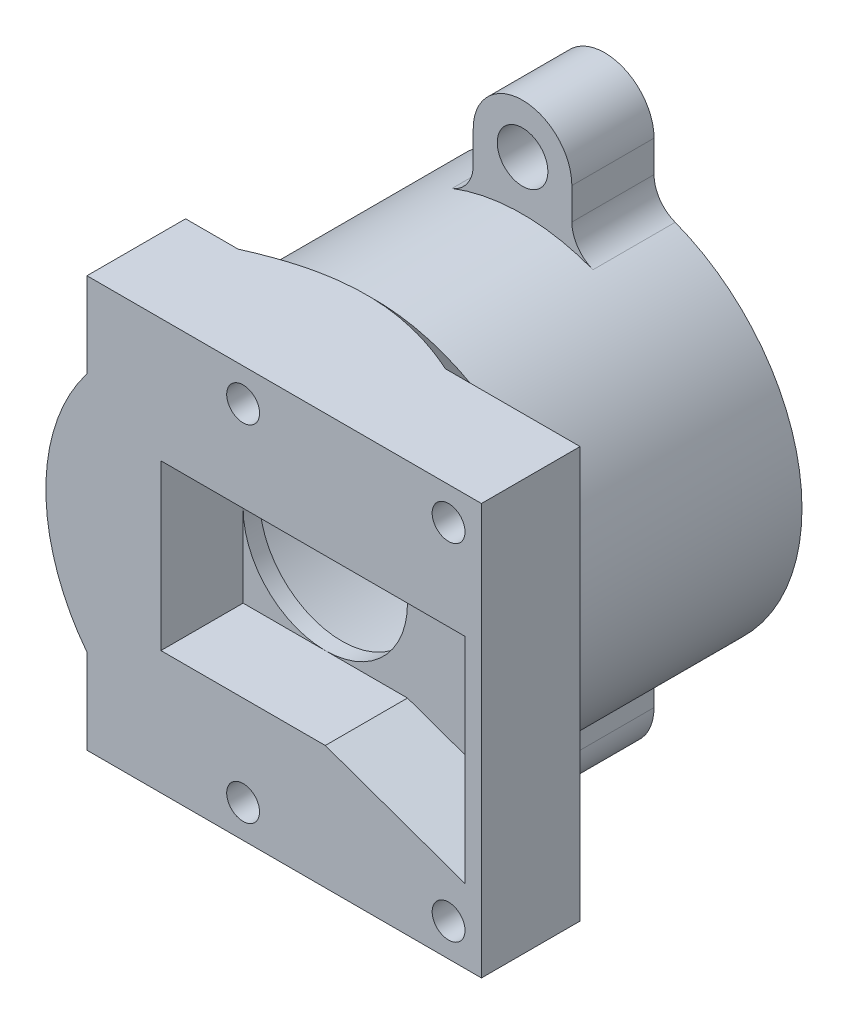
from build123d import *
from build123d.topology import SkipClean

# Parameters (mm, degrees)
SKETCH1_R               = 12
SKETCH1_R_2             = 4.75
BOSS_EXTRUDE1_DEPTH     = 2
SKETCH2_R               = 12
SKETCH2_R_2             = 10.871602624
BOSS_EXTRUDE3_DEPTH     = 20
BOSS_EXTRUDE4_START     = -5
SKETCH3_R               = 1.539073807
BOSS_EXTRUDE4_DEPTH     = 5
BOSS_EXTRUDE4_2_DEPTH   = 5
BOSS_EXTRUDE5_START     = -5
BOSS_EXTRUDE5_OUTLINE_R = 1
BOSS_EXTRUDE5_DEPTH     = 5
SKETCH5_4_R             = 1
CUT_EXTRUDE4_DEPTH      = 5
SKETCH6_R               = 1
BOSS_EXTRUDE11_DEPTH    = 1
CHAMFER1_SIZE           = 2
FILLET2_START           = -22
FILLET2_DEPTH           = 5
SKETCH7_R               = 12
BOSS_EXTRUDE13_DEPTH    = 1


with BuildPart() as part:
    # Sketch1 → Boss-Extrude1 (new body)
    with BuildSketch(Plane(origin=(0, 0, 0), x_dir=(0, 1, 0), z_dir=(0, 0, 1))):
        with Locations(Location((0, 0, 0), (0, 0, 270))):
            Circle(SKETCH1_R)
        with Locations(Location((0, 0, 0), (0, 0, 270))):
            Circle(SKETCH1_R_2, mode=Mode.SUBTRACT)
    extrude(amount=-BOSS_EXTRUDE1_DEPTH)

    # Sketch2 → Boss-Extrude3 (add)
    with BuildSketch(Plane(origin=(0, 0, -2), x_dir=(1, 0, 0), z_dir=(0, 0, -1))):
        Circle(SKETCH2_R)
        with Locations(Location((0, 0, 0), (0, 0, 180))):
            Circle(SKETCH2_R_2, mode=Mode.SUBTRACT)
    extrude(amount=BOSS_EXTRUDE3_DEPTH)

    # Boss-Extrude5: read off the stored shape, not the designer's step
    # Boss-Extrude5 outline → Boss-Extrude5 (add)
    # profile 1 of 2: a face of its own
    with BuildSketch(Plane.XY.offset(BOSS_EXTRUDE5_START)):
        with BuildLine():
            ThreePointArc((0.943785252, -10.83055922), (5.369140506, -9.453257314), (8.818682626, -6.357875459))
            Line((8.818682626, -6.357875459), (5, -5))
            Line((5, -5), (-5, -5))
            Line((-5, -5), (-5, 5))
            Line((-5, 5), (9.653587085, 5))
            ThreePointArc((9.653587085, 5), (6.047721085, 9.034202416), (0.943785252, 10.83055922))
            ThreePointArc((0.943785252, 10.83055922), (0, 9.5), (-0.943785252, 10.83055922))
            ThreePointArc((-0.943785252, 10.83055922), (-10.871602624, 0), (-0.943785252, -10.83055922))
            ThreePointArc((-0.943785252, -10.83055922), (0, -9.5), (0.943785252, -10.83055922))
        make_face()
    # profile 2 of 2: a face of its own
    with BuildSketch(Plane.XY.offset(BOSS_EXTRUDE5_START)):
        with BuildLine():
            Line((13.5, 5), (13.5, -8.022492971))
            Line((13.5, -8.022492971), (9.921541449, -6.750038169))
            ThreePointArc((9.921541449, -6.750038169), (0.359069733, -11.994626669), (-9.5, -7.331439149))
            Line((-9.5, -7.331439149), (-9.5, -12.5))
            Line((-9.5, -12.5), (14.5, -12.5))
            Line((14.5, -12.5), (14.5, 12.5))
            Line((14.5, 12.5), (-9.5, 12.5))
            Line((-9.5, 12.5), (-9.5, 7.331439149))
            ThreePointArc((-9.5, 7.331439149), (1.361991036, 11.922456979), (10.908712115, 5))
            Line((10.908712115, 5), (13.5, 5))
        make_face()
        with Locations((12.5, -10.5)):
            Circle(BOSS_EXTRUDE5_OUTLINE_R, mode=Mode.SUBTRACT)
        with Locations((12.5, 10.5)):
            Circle(BOSS_EXTRUDE5_OUTLINE_R, mode=Mode.SUBTRACT)
    extrude(amount=BOSS_EXTRUDE5_DEPTH)

    # Sketch5<4> → Cut-Extrude4 (cut)
    with SkipClean():  # the faces are left unmerged after this step: merging them gives an invalid solid
        with BuildSketch(Plane.XY):
            with BuildLine():
                ThreePointArc((-4.75, 0), (-3.358757211, 3.358757211), (0, 4.75))
                Line((0, 4.75), (0, 5))
                Line((0, 5), (-5, 5))
                Line((-5, 5), (-5, 0))
                Line((-5, 0), (-4.75, 0))
            make_face()
            with BuildLine():
                ThreePointArc((0, 4.75), (3.358757211, 3.358757211), (4.75, 0))
                Line((4.75, 0), (5, 0))
                Line((5, 0), (5, 5))
                Line((5, 5), (0, 5))
                Line((0, 5), (0, 4.75))
            make_face()
            with BuildLine():
                Line((5, 0), (4.75, 0))
                ThreePointArc((4.75, 0), (0, -4.75), (-4.75, 0))
                Line((-4.75, 0), (-5, 0))
                Line((-5, 0), (-5, -5))
                Line((-5, -5), (5, -5))
                Line((5, -5), (5, 0))
            make_face()
            with BuildLine():
                ThreePointArc((1, 10.5), (-0.707106781, 11.207106781), (0, 9.5))
                Line((0, 9.5), (0, 10.5))
                Line((0, 10.5), (1, 10.5))
            make_face()
            with BuildLine():
                Line((0, 10.5), (0, 9.5))
                ThreePointArc((0, 9.5), (0.707106781, 9.792893219), (1, 10.5))
                Line((1, 10.5), (0, 10.5))
            make_face()
            with Locations((0, -10.5)):
                Circle(SKETCH5_4_R)
            with BuildLine():
                Line((12, 0), (5, 0))
                Line((5, 0), (5, -5))
                Line((5, -5), (10.908712115, -5))
                ThreePointArc((10.908712115, -5), (11.724004123, -2.558852734), (12, 0))
            make_face()
            with BuildLine():
                Line((5, 5), (5, 0))
                Line((5, 0), (12, 0))
                ThreePointArc((12, 0), (11.724004123, 2.558852734), (10.908712115, 5))
                Line((10.908712115, 5), (5, 5))
            make_face()
            with BuildLine():
                Line((10.908712115, -5), (5, -5))
                Line((5, -5), (9.921541449, -6.750038169))
                ThreePointArc((9.921541449, -6.750038169), (10.451819185, -5.895716727), (10.908712115, -5))
            make_face()
        extrude(amount=-CUT_EXTRUDE4_DEPTH, mode=Mode.SUBTRACT)

    # Sketch6 → Boss-Extrude11 (add)
    # profile 1 of 4: a face of its own
    with SkipClean():  # the faces are left unmerged after this step: merging them gives an invalid solid
        with BuildSketch(Plane(origin=(0, 0, -5), x_dir=(1, 0, 0), z_dir=(0, 0, -1))):
            with BuildLine():
                Line((-9.5, 12.5), (-9.5, 7.331439149))
                ThreePointArc((-9.5, 7.331439149), (0.359069733, 11.994626669), (9.921541449, 6.750038169))
                Line((9.921541449, 6.750038169), (13.5, 8.022492971))
                Line((13.5, 8.022492971), (13.5, -5))
                Line((13.5, -5), (10.908712115, -5))
                ThreePointArc((10.908712115, -5), (1.361991036, -11.922456979), (-9.5, -7.331439149))
                Line((-9.5, -7.331439149), (-9.5, -12.5))
                Line((-9.5, -12.5), (14.5, -12.5))
                Line((14.5, -12.5), (14.5, 12.5))
                Line((14.5, 12.5), (-9.5, 12.5))
            make_face()
            with Locations((12.5, -10.5)):
                Circle(SKETCH6_R, mode=Mode.SUBTRACT)
            with Locations((12.5, 10.5)):
                Circle(SKETCH6_R, mode=Mode.SUBTRACT)
        # profile 2 of 4: a face of its own
        with BuildSketch(Plane(origin=(0, 0, -5), x_dir=(1, 0, 0), z_dir=(0, 0, -1))):
            with BuildLine():
                Line((13.5, 8.022492971), (9.921541449, 6.750038169))
                ThreePointArc((9.921541449, 6.750038169), (11.468620174, 3.531395094), (12, 0))
                ThreePointArc((12, 0), (11.724004123, -2.558852734), (10.908712115, -5))
                Line((10.908712115, -5), (13.5, -5))
                Line((13.5, -5), (13.5, 8.022492971))
            make_face()
        # profile 3 of 4: a face of its own
        with BuildSketch(Plane(origin=(0, 0, -5), x_dir=(1, 0, 0), z_dir=(0, 0, -1))):
            with Locations((12.5, 10.5)):
                Circle(SKETCH6_R)
        # profile 4 of 4: a face of its own
        with BuildSketch(Plane(origin=(0, 0, -5), x_dir=(1, 0, 0), z_dir=(0, 0, -1))):
            with Locations((12.5, -10.5)):
                Circle(SKETCH6_R)
        extrude(amount=BOSS_EXTRUDE11_DEPTH)

    # Chamfer1
    # the kernel refuses this chamfer: 2 mm, written as the material it adds along each edge
    with BuildSketch(Plane(origin=(0, 0, -6), x_dir=(1, 0, 0), z_dir=(0, 1, 0))) as chamfer1_piece_1_section:
        Polygon((12, CHAMFER1_SIZE), (12 + CHAMFER1_SIZE, 0), (12, 0), align=None)
    chamfer1_piece_1 = revolve(axis=Axis((0, 0, -6), (0, 0, -1)), revolution_arc=166.923988161, mode=Mode.PRIVATE)
    chamfer1_piece_1 = split(chamfer1_piece_1, bisect_by=Plane(origin=(-9.5, 0, -6), z_dir=(1, 0, 0)), keep=Keep.TOP, mode=Mode.PRIVATE)
    chamfer1_piece_1 = split(chamfer1_piece_1, bisect_by=Plane(origin=(0, -12.5, -6), z_dir=(0, 1, 0)), keep=Keep.TOP, mode=Mode.PRIVATE)
    add(chamfer1_piece_1)
    with BuildSketch(Plane(origin=(0, 0, -6), x_dir=(-0.9740707745580937, 0.22624351073963517, 0), z_dir=(-0.22624351073963517, -0.9740707745580937, 0))) as chamfer1_piece_2_section:
        Polygon((12, CHAMFER1_SIZE), (12 + CHAMFER1_SIZE, 0), (12, 0), align=None)
    chamfer1_piece_2 = revolve(axis=Axis((0, 0, -6), (0, 0, -1)), revolution_arc=166.923988161, mode=Mode.PRIVATE)
    chamfer1_piece_2 = split(chamfer1_piece_2, bisect_by=Plane(origin=(-9.5, 0, -6), z_dir=(1, 0, 0)), keep=Keep.TOP, mode=Mode.PRIVATE)
    chamfer1_piece_2 = split(chamfer1_piece_2, bisect_by=Plane(origin=(0, 12.5, -6), z_dir=(0, -1, 0)), keep=Keep.TOP, mode=Mode.PRIVATE)
    add(chamfer1_piece_2)


with BuildPart() as body_2:
    # Sketch3 → Boss-Extrude4 (new body)
    with BuildSketch(Plane(origin=(0, 0, -22), x_dir=(1, 0, 0), z_dir=(0, 0, -1)).offset(BOSS_EXTRUDE4_START)):
        with BuildLine():
            Line((3, 11.618950039), (3, 15))
            ThreePointArc((3, 15), (0, 18), (-3, 15))
            Line((-3, 15), (-3, 11.618950039))
            ThreePointArc((-3, 11.618950039), (-1.512051513, 11.904356355), (-6e-09, 12))
            ThreePointArc((-6e-09, 12), (1.512051507, 11.904356356), (3, 11.618950039))
        make_face()
        with Locations(Location((0, 15, 0), (0, 0, 180))):
            Circle(SKETCH3_R, mode=Mode.SUBTRACT)
    extrude(amount=BOSS_EXTRUDE4_DEPTH)


with BuildPart() as body_3:
    # Sketch3 → Boss-Extrude4 2 (new body)
    with BuildSketch(Plane(origin=(0, 0, -22), x_dir=(1, 0, 0), z_dir=(0, 0, -1)).offset(BOSS_EXTRUDE4_START)):
        with BuildLine():
            Line((-3, -11.618950039), (-3, -15))
            ThreePointArc((-3, -15), (0, -18), (3, -15))
            Line((3, -15), (3, -11.618950039))
            ThreePointArc((3, -11.618950039), (0, -12), (-3, -11.618950039))
        make_face()
        with Locations(Location((0, -15, 0), (0, 0, 180))):
            Circle(SKETCH3_R, mode=Mode.SUBTRACT)
    extrude(amount=BOSS_EXTRUDE4_2_DEPTH)


with BuildPart() as body_2_1:
    add(body_2.part)

    # Combine1: union body 3, part
    add(body_3.part)
    add(part.part)

    # Fillet2: read off the stored shape, not the designer's step
    # Fillet2 outline → Fillet2 (add)
    with SkipClean():  # the faces are left unmerged after this step: merging them gives an invalid solid
        with BuildSketch(Plane.XY.offset(FILLET2_START)):
            with BuildLine():
                ThreePointArc((4.285714286, 11.208597283), (3.352491058, 11.942803412), (3, 13.076696831))
                Line((3, 13.076696831), (3, 11.618950039))
                ThreePointArc((3, 11.618950039), (3.648630635, 11.431863124), (4.285714286, 11.208597283))
            make_face()
            with BuildLine():
                ThreePointArc((-4.285714286, 11.208597283), (-3.648630635, 11.431863124), (-3, 11.618950039))
                Line((-3, 11.618950039), (-3, 13.076696831))
                ThreePointArc((-3, 13.076696831), (-3.352491058, 11.942803412), (-4.285714286, 11.208597283))
            make_face()
            with BuildLine():
                ThreePointArc((3, -13.076696831), (3.352491058, -11.942803412), (4.285714286, -11.208597283))
                ThreePointArc((4.285714286, -11.208597283), (3.648630635, -11.431863124), (3, -11.618950039))
                Line((3, -11.618950039), (3, -13.076696831))
            make_face()
            with BuildLine():
                ThreePointArc((-3, -11.618950039), (-3.648630635, -11.431863124), (-4.285714286, -11.208597283))
                ThreePointArc((-4.285714286, -11.208597283), (-3.352491058, -11.942803412), (-3, -13.076696831))
                Line((-3, -13.076696831), (-3, -11.618950039))
            make_face()
        extrude(amount=FILLET2_DEPTH)
    add(body_2_1.part.scale(1), mode=Mode.REPLACE)  # the faces are merged on a copy

    # Sketch7 → Boss-Extrude13 (add)
    # profile 1 of 4: a face of its own
    with BuildSketch(Plane(origin=(0, 0, -5), x_dir=(1, 0, 0), z_dir=(0, 0, -1))):
        with Locations(Location((0, 0, 0), (0, 0, 290.924832428))):
            Circle(SKETCH7_R)
        with BuildLine():
            ThreePointArc((0, 5), (3.535533906, 3.535533906), (5, 0))
            ThreePointArc((5, 0), (3.535533906, -3.535533906), (0, -5))
            Line((0, -5), (9.653587086, -5))
            ThreePointArc((9.653587086, -5), (6.047721085, -9.034202416), (0.943785252, -10.83055922))
            ThreePointArc((0.943785252, -10.83055922), (0, -9.5), (-0.943785252, -10.83055922))
            ThreePointArc((-0.943785252, -10.83055922), (-10.871602624, 0), (-0.943785252, 10.83055922))
            ThreePointArc((-0.943785252, 10.83055922), (0, 9.5), (0.943785252, 10.83055922))
            ThreePointArc((0.943785252, 10.83055922), (5.369140507, 9.453257314), (8.818682627, 6.357875459))
            Line((8.818682627, 6.357875459), (5, 5))
            Line((5, 5), (0, 5))
        make_face(mode=Mode.SUBTRACT)
    # profile 2 of 4: a face of its own
    with BuildSketch(Plane(origin=(0, 0, -5), x_dir=(1, 0, 0), z_dir=(0, 0, -1))):
        with BuildLine():
            ThreePointArc((-0.943785252, -10.83055922), (0, -9.5), (0.943785252, -10.83055922))
            ThreePointArc((0.943785252, -10.83055922), (6.047721085, -9.034202416), (9.653587086, -5))
            Line((9.653587086, -5), (-5, -5))
            Line((-5, -5), (-5, 5))
            Line((-5, 5), (5, 5))
            Line((5, 5), (8.818682627, 6.357875459))
            ThreePointArc((8.818682627, 6.357875459), (5.369140507, 9.453257314), (0.943785252, 10.83055922))
            ThreePointArc((0.943785252, 10.83055922), (0, 9.5), (-0.943785252, 10.83055922))
            ThreePointArc((-0.943785252, 10.83055922), (-10.871602624, 0), (-0.943785252, -10.83055922))
        make_face()
    # profile 3 of 4: a face of its own
    with BuildSketch(Plane(origin=(0, 0, -5), x_dir=(1, 0, 0), z_dir=(0, 0, -1))):
        with BuildLine():
            ThreePointArc((-5, 0), (-3.535533906, 3.535533906), (0, 5))
            Line((0, 5), (-5, 5))
            Line((-5, 5), (-5, 0))
        make_face()
    # profile 4 of 4: a face of its own
    with BuildSketch(Plane(origin=(0, 0, -5), x_dir=(1, 0, 0), z_dir=(0, 0, -1))):
        with BuildLine():
            Line((-5, -5), (0, -5))
            ThreePointArc((0, -5), (-3.535533906, -3.535533906), (-5, 0))
            Line((-5, 0), (-5, -5))
        make_face()
    extrude(amount=BOSS_EXTRUDE13_DEPTH)


solid = body_2_1.part
